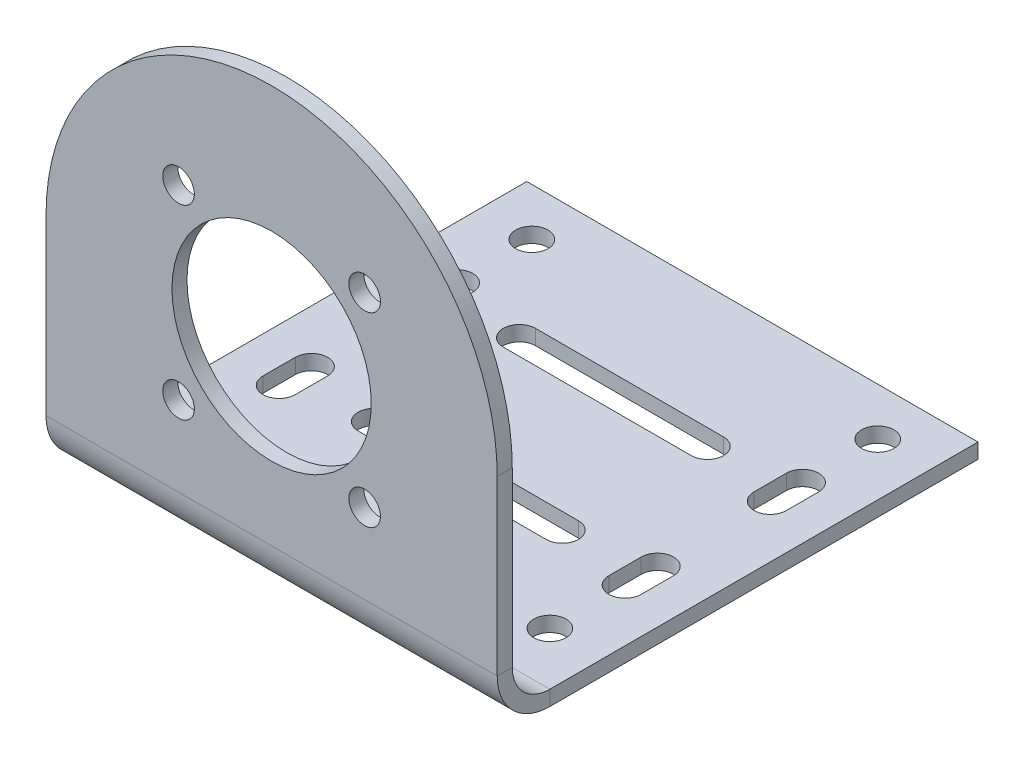
from build123d import *

# Parameters (mm, degrees)
BOSS_EXTRUDE2_DEPTH          = 2
SKETCH2_R                    = 13.25
CUT_EXTRUDE1_DEPTH           = 62.54645277
EDGE_FLANGE1_STRIP_W         = 18
EDGE_FLANGE1_STRIP_H         = 2
EDGE_FLANGE1_STRIP_CUT_DEPTH = 60
EDGE_FLANGE1_DEPTH           = 60
SKETCH12_R                   = 2.1
CUT_EXTRUDE2_DEPTH           = 89.718717014
SKETCH13_R                   = 2.15
CUT_EXTRUDE3_DEPTH           = 2


# Sheet-metal steps are written as plain solids
with BuildPart() as part:
    # Sketch1 → Boss-Extrude2 (new body)
    with BuildSketch(Plane.XY):
        with BuildLine():
            Line((51.588785047, -26.495327103), (-8.411214953, -26.495327103))
            Line((-8.411214953, -26.495327103), (-8.411214953, 3.504672897))
            ThreePointArc((-8.411214953, 3.504672897), (21.588785047, 33.504672897), (51.588785047, 3.504672897))
            Line((51.588785047, 3.504672897), (51.588785047, -26.495327103))
        make_face()
    extrude(amount=BOSS_EXTRUDE2_DEPTH)

    # Sketch2 → Cut-Extrude1 (cut, through all)
    with BuildSketch(Plane.XY.offset(2)):
        with Locations((21.588785047, 3.504672897)):
            Circle(SKETCH2_R)
    extrude(amount=-CUT_EXTRUDE1_DEPTH, mode=Mode.SUBTRACT)

    # Edge-Flange1 strip (across the edge) → Edge-Flange1 strip cut (cut)
    with BuildSketch(Plane(origin=(51.588785047, -26.495327103, 0), x_dir=(0, 1, 0), z_dir=(-1, 0, 0))):
        with Locations((-2, -1)):
            Rectangle(EDGE_FLANGE1_STRIP_W, EDGE_FLANGE1_STRIP_H)
    extrude(amount=EDGE_FLANGE1_STRIP_CUT_DEPTH, mode=Mode.SUBTRACT)

    # Edge-Flange1 section (across the edge) → Edge-Flange1 (add)
    with BuildSketch(Plane(origin=(51.588785047, -26.495327103, 0), x_dir=(0, 1, 0), z_dir=(-1, 0, 0))):
        with BuildLine():
            Line((0, 5), (0, 61.93))
            Line((0, 61.93), (2, 61.93))
            Line((2, 61.93), (2, 5))
            ThreePointArc((2, 5), (3.464466094, 1.464466094), (7, 0))
            Line((7, 0), (7, -2))
            ThreePointArc((7, -2), (2.050252532, 0.050252532), (0, 5))
        make_face()
    extrude(amount=EDGE_FLANGE1_DEPTH)

    # Sketch12 → Cut-Extrude2 (cut, through all)
    with BuildSketch(Plane.XY.offset(2)):
        with Locations((33.963153717, 15.879041568)):
            Circle(SKETCH12_R)
        with Locations((33.963153717, -8.869695774)):
            Circle(SKETCH12_R)
        with Locations((9.214416376, -8.869695774)):
            Circle(SKETCH12_R)
        with Locations((9.214416376, 15.879041568)):
            Circle(SKETCH12_R)
    extrude(amount=-CUT_EXTRUDE2_DEPTH, mode=Mode.SUBTRACT)

    # Sketch13 → Cut-Extrude3 (cut)
    with BuildSketch(Plane.XZ.offset(26.495327103)):
        with Locations(Location((-1.411214953, -12, 0), (0, 0, 270))):
            Circle(SKETCH13_R)
        with Locations(Location((44.588785047, -12, 0), (0, 0, 270))):
            Circle(SKETCH13_R)
        with Locations(Location((44.588785047, -55.6, 0), (0, 0, 270))):
            Circle(SKETCH13_R)
        with Locations(Location((-1.411214953, -55.6, 0), (0, 0, 270))):
            Circle(SKETCH13_R)
        with BuildLine():
            Line((-3.561214953, -41.3), (-3.561214953, -45.6))
            ThreePointArc((-3.561214953, -45.6), (-1.411214953, -47.75), (0.738785047, -45.6))
            Line((0.738785047, -45.6), (0.738785047, -41.3))
            ThreePointArc((0.738785047, -41.3), (-1.411214953, -39.15), (-3.561214953, -41.3))
        make_face()
        with BuildLine():
            Line((-3.561214953, -22), (-3.561214953, -26.3))
            ThreePointArc((-3.561214953, -26.3), (-1.411214953, -28.45), (0.738785047, -26.3))
            Line((0.738785047, -26.3), (0.738785047, -22))
            ThreePointArc((0.738785047, -22), (-1.411214953, -19.85), (-3.561214953, -22))
        make_face()
        with BuildLine():
            Line((46.738785047, -26.3), (46.738785047, -22))
            ThreePointArc((46.738785047, -22), (44.588785047, -19.85), (42.438785047, -22))
            Line((42.438785047, -22), (42.438785047, -26.3))
            ThreePointArc((42.438785047, -26.3), (44.588785047, -28.45), (46.738785047, -26.3))
        make_face()
        with BuildLine():
            Line((42.438785047, -41.3), (42.438785047, -45.6))
            ThreePointArc((42.438785047, -45.6), (44.588785047, -47.75), (46.738785047, -45.6))
            Line((46.738785047, -45.6), (46.738785047, -41.3))
            ThreePointArc((46.738785047, -41.3), (44.588785047, -39.15), (42.438785047, -41.3))
        make_face()
        with BuildLine():
            Line((9.088785047, -22), (34.088785047, -22))
            ThreePointArc((34.088785047, -22), (36.238785047, -24.15), (34.088785047, -26.3))
            Line((34.088785047, -26.3), (9.088785047, -26.3))
            ThreePointArc((9.088785047, -26.3), (6.938785047, -24.15), (9.088785047, -22))
        make_face()
        with BuildLine():
            Line((9.088785047, -41.3), (34.088785047, -41.3))
            ThreePointArc((34.088785047, -41.3), (36.238785047, -43.45), (34.088785047, -45.6))
            Line((34.088785047, -45.6), (9.088785047, -45.6))
            ThreePointArc((9.088785047, -45.6), (6.938785047, -43.45), (9.088785047, -41.3))
        make_face()
    extrude(amount=-CUT_EXTRUDE3_DEPTH, mode=Mode.SUBTRACT)


solid = part.part
